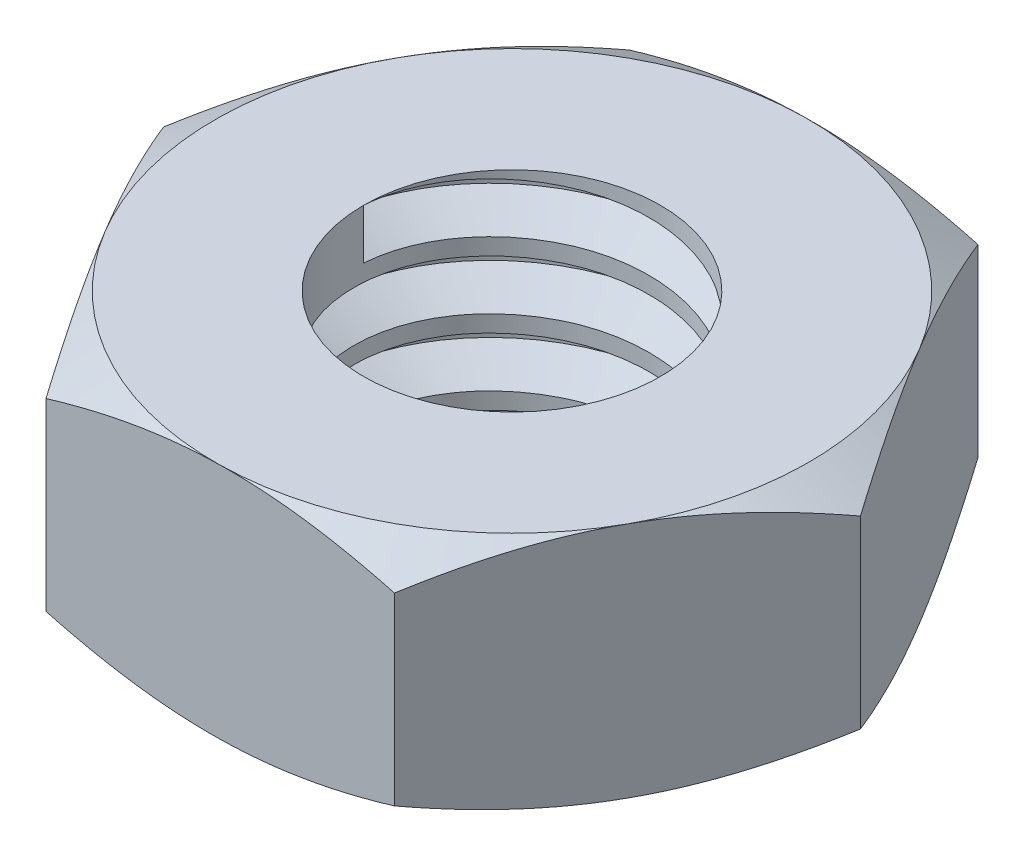
from build123d import *

# Parameters (mm, degrees)
BOSS_EXTRUDE1_DEPTH = 1.6
SKETCH2_R           = 1
CUT_EXTRUDE1_DEPTH  = 4.459587692
SKETCH3_OUTSIDE_W   = 13.428
SKETCH3_OUTSIDE_H   = 12.848
SKETCH3_OUTSIDE_R   = 2
CUT_EXTRUDE2_DEPTH  = 1.6
CUT_EXTRUDE2_DRAFT  = -60
SKETCH4_OUTSIDE_W   = 13.428
SKETCH4_OUTSIDE_H   = 12.848
SKETCH4_OUTSIDE_R   = 2
CUT_EXTRUDE3_DEPTH  = 1.6
CUT_EXTRUDE3_DRAFT  = -60
THREAD1_PITCH       = 0.45


with BuildPart() as part:
    # Sketch1 → Boss-Extrude1 (new body)
    with BuildSketch(Plane(origin=(0, 0, 0), x_dir=(1, 0, 0), z_dir=(0, 1, 0))):
        Polygon((1.188177052, -1.980295086), (2.309074377, 0.038843968), (1.120897326, 2.019139054), (-1.188177052, 1.980295086), (-2.309074377, -0.038843968), (-1.120897326, -2.019139054), align=None)
    extrude(amount=BOSS_EXTRUDE1_DEPTH)

    # Sketch2 → Cut-Extrude1 (cut, through all)
    with BuildSketch(Plane(origin=(0, 1.6, 0), x_dir=(1, 0, 0), z_dir=(0, 1, 0))):
        with Locations(Location((0, 0, 0), (0, 0, 270))):
            Circle(SKETCH2_R)
    extrude(amount=-CUT_EXTRUDE1_DEPTH, mode=Mode.SUBTRACT)


with BuildPart() as cut_extrude2_tool:
    # Sketch3 outside → Cut-Extrude2 (with draft: the straight prism first)
    with BuildSketch(Plane(origin=(0, 1.6, 0), x_dir=(1, 0, 0), z_dir=(0, 1, 0))):
        Rectangle(SKETCH3_OUTSIDE_W, SKETCH3_OUTSIDE_H)
        Circle(SKETCH3_OUTSIDE_R, mode=Mode.SUBTRACT)
    extrude(amount=-CUT_EXTRUDE2_DEPTH)
    # Cut-Extrude2: the draft: its side faces are tilted about the plane it starts from
    cut_extrude2_sides = [cut_extrude2_tool.faces().sort_by_distance(p)[0] for p in [
        (0, 0.8, 6.424),
        (6.714, 0.8, 0),
        (0, 0.8, -6.424),
        (-6.714, 0.8, 0),
        (-2, 0.8, 0),
    ]]
    draft(cut_extrude2_sides, Plane(origin=(0, 1.6, 0), x_dir=(1, 0, 0), z_dir=(0, 1, 0)), CUT_EXTRUDE2_DRAFT)


with BuildPart() as part_1:
    add(part.part)

    # Cut-Extrude2: cut by cut_extrude2_tool
    add(cut_extrude2_tool.part, mode=Mode.SUBTRACT)


with BuildPart() as cut_extrude3_tool:
    # Sketch4 outside → Cut-Extrude3 (with draft: the straight prism first)
    with BuildSketch(Plane.XZ):
        Rectangle(SKETCH4_OUTSIDE_W, SKETCH4_OUTSIDE_H)
        Circle(SKETCH4_OUTSIDE_R, mode=Mode.SUBTRACT)
    extrude(amount=-CUT_EXTRUDE3_DEPTH)
    # Cut-Extrude3: the draft: its side faces are tilted about the plane it starts from
    cut_extrude3_sides = [cut_extrude3_tool.faces().sort_by_distance(p)[0] for p in [
        (0, 0.8, -6.424),
        (6.714, 0.8, 0),
        (0, 0.8, 6.424),
        (-6.714, 0.8, 0),
        (-2, 0.8, 0),
    ]]
    draft(cut_extrude3_sides, Plane.XZ, CUT_EXTRUDE3_DRAFT)


with BuildPart() as part_2:
    add(part_1.part)

    # Cut-Extrude3: cut by cut_extrude3_tool
    add(cut_extrude3_tool.part, mode=Mode.SUBTRACT)

    # Thread1: the profile of Thread Profile1 profile screwed along a right-hand helix of 4.444444 turns, 6 arcs to a turn; built about Z, then put on its axis
    thread1_z = Axis((0, 0, 0), (0, 0, 1))
    thread1_corners = [(0.9997, 0, -0.000173205), (1.243569644, 0, 0.140624999), (1.243569644, 0, 0.196874999), (0.9997, 0, 0.337673204)]
    with BuildLine(mode=Mode.PRIVATE) as thread1_profile:
        Line(thread1_corners[0], thread1_corners[1])
        Line(thread1_corners[1], thread1_corners[2])
        Line(thread1_corners[2], thread1_corners[3])
        Line(thread1_corners[3], thread1_corners[0])
    thread1_cap = Face(thread1_profile.wire())
    thread1_turn_angles = [0, 30, 60, 90, 120, 150, 180, 210, 240, 270, 300, 330, 360]
    thread1_turn_weights = [1, 0.8660254037844387, 1, 0.8660254037844387, 1, 0.8660254037844387, 1, 0.8660254037844387, 1, 0.8660254037844387, 1, 0.8660254037844387, 1]
    thread1_turn_rails = [Edge.make_bspline([Vector(p[0], p[1], 0).rotate(thread1_z, thread1_turn_angles[k]) / thread1_turn_weights[k] + Vector(0, 0, p[2] + THREAD1_PITCH * thread1_turn_angles[k] / 360) for k in range(13)], [0, 0, 0, 1, 1, 2, 2, 3, 3, 4, 4, 5, 5, 6, 6, 6], 2, thread1_turn_weights) for p in thread1_corners]
    thread1_turn_sides = [Face.make_surface_from_curves(thread1_turn_rails[p[0]], thread1_turn_rails[p[1]]) for p in [(0, 1), (1, 2), (2, 3), (3, 0)]]
    thread1_last_angles = [1440, 1470, 1500, 1530, 1560, 1580, 1600]
    thread1_last_weights = [1, 0.8660254037844387, 1, 0.8660254037844387, 1, 0.9396926207859078, 1]
    thread1_last_rails = [Edge.make_bspline([Vector(p[0], p[1], 0).rotate(thread1_z, thread1_last_angles[k]) / thread1_last_weights[k] + Vector(0, 0, p[2] + THREAD1_PITCH * thread1_last_angles[k] / 360) for k in range(7)], [0, 0, 0, 1, 1, 2, 2, 3, 3, 3], 2, thread1_last_weights) for p in thread1_corners]
    thread1_last_sides = [Face.make_surface_from_curves(thread1_last_rails[p[0]], thread1_last_rails[p[1]]) for p in [(0, 1), (1, 2), (2, 3), (3, 0)]]
    thread1 = Plane(origin=(0, 1.6, 0), x_dir=(-1, 0, 0), z_dir=(0, -1, 0)) * Solid(Shell([*[p.moved(Location((0, 0, THREAD1_PITCH * i))) for i in range(4) for p in thread1_turn_sides], *thread1_last_sides, thread1_cap, thread1_cap.rotate(thread1_z, 1600).moved(Location((0, 0, THREAD1_PITCH * 1600 / 360)))]))
    add(thread1, mode=Mode.SUBTRACT)


solid = part_2.part
